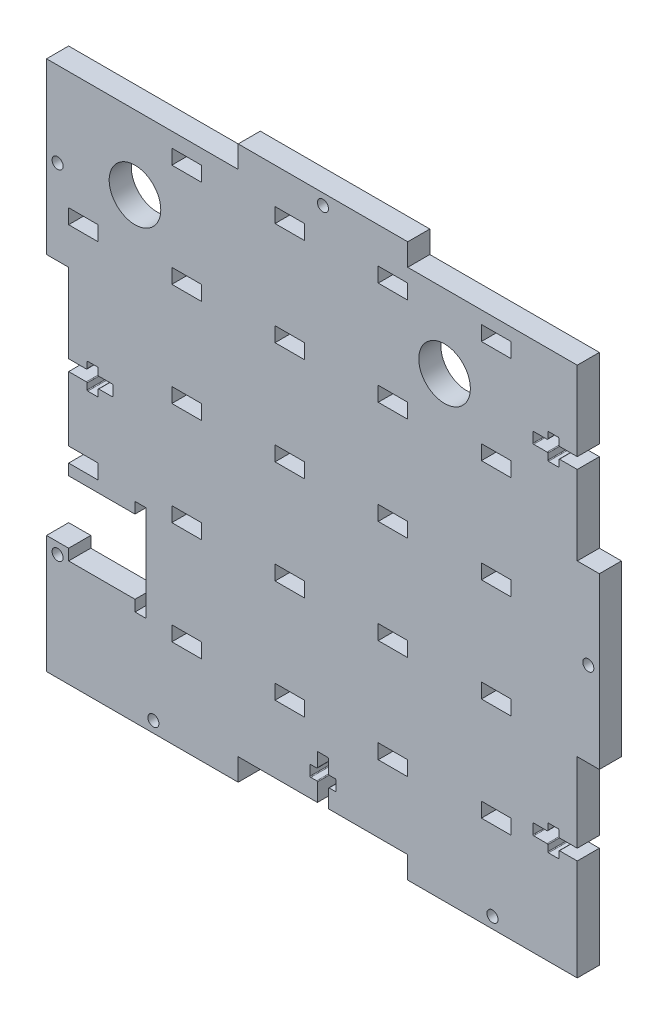
from build123d import *

# Parameters (mm, degrees)
BOX_SIDE_DEPTH       = 6
SKETCH2_R            = 1.5
SCREW_CUT_OUTS_DEPTH = 107.235587258
CUT_EXTRUDE1_DEPTH   = 107.235587258
SKETCH4_W            = 8
SKETCH4_H            = 4
CUT_EXTRUDE2_DEPTH   = 107.235587258
SKETCH5_R            = 7
CUT_EXTRUDE3_DEPTH   = 107.235587258


with BuildPart() as part:
    # Sketch1 → Box Side (new body)
    with BuildSketch(Plane.XY):
        Polygon((-69, 69), (-23, 69), (-23, 75), (23, 75), (23, 69), (69, 69), (69, 23), (75, 23), (75, -23), (69, -23), (69, -69), (69, -75), (23, -75), (23, -69), (-23, -69), (-23, -75), (-69, -75), (-75, -75), (-75, -69), (-75, -23), (-69, -23), (-69, 23), (-75, 23), (-75, 69), align=None)
    extrude(amount=BOX_SIDE_DEPTH)

    # Sketch2 → Screw Cut-outs (cut, through all)
    with BuildSketch(Plane.XY.offset(6)):
        with Locations((0, 72)):
            Circle(SKETCH2_R)
        with Locations((72, 0)):
            Circle(SKETCH2_R)
        with Locations((-46, -72)):
            Circle(SKETCH2_R)
        with Locations((46, -72)):
            Circle(SKETCH2_R)
        with Locations((-72, 46)):
            Circle(SKETCH2_R)
        with Locations((-72, -46)):
            Circle(SKETCH2_R)
        with BuildLine():
            Line((69, 44.5), (64.2, 44.5))
            ThreePointArc((64.2, 44.5), (64.058578644, 44.441421356), (64, 44.3))
            Line((64, 44.3), (64, 42.7))
            ThreePointArc((64, 42.7), (63.941421356, 42.558578644), (63.8, 42.5))
            Line((63.8, 42.5), (61.2, 42.5))
            ThreePointArc((61.2, 42.5), (61.058578644, 42.558578644), (61, 42.7))
            Line((61, 42.7), (61, 44.3))
            ThreePointArc((61, 44.3), (60.941421356, 44.441421356), (60.8, 44.5))
            Line((60.8, 44.5), (57.2, 44.5))
            ThreePointArc((57.2, 44.5), (57.058578644, 44.558578644), (57, 44.7))
            Line((57, 44.7), (57, 47.3))
            ThreePointArc((57, 47.3), (57.058578644, 47.441421356), (57.2, 47.5))
            Line((57.2, 47.5), (60.8, 47.5))
            ThreePointArc((60.8, 47.5), (60.941421356, 47.558578644), (61, 47.7))
            Line((61, 47.7), (61, 49.3))
            ThreePointArc((61, 49.3), (61.058578644, 49.441421356), (61.2, 49.5))
            Line((61.2, 49.5), (63.8, 49.5))
            ThreePointArc((63.8, 49.5), (63.941421356, 49.441421356), (64, 49.3))
            Line((64, 49.3), (64, 47.7))
            ThreePointArc((64, 47.7), (64.058578644, 47.558578644), (64.2, 47.5))
            Line((64.2, 47.5), (69, 47.5))
            Line((69, 47.5), (69, 44.5))
        make_face()
        with BuildLine():
            Line((69, -47.5), (64.2, -47.5))
            ThreePointArc((64.2, -47.5), (64.058578644, -47.558578644), (64, -47.7))
            Line((64, -47.7), (64, -49.3))
            ThreePointArc((64, -49.3), (63.941421356, -49.441421356), (63.8, -49.5))
            Line((63.8, -49.5), (61.2, -49.5))
            ThreePointArc((61.2, -49.5), (61.058578644, -49.441421356), (61, -49.3))
            Line((61, -49.3), (61, -47.7))
            ThreePointArc((61, -47.7), (60.941421356, -47.558578644), (60.8, -47.5))
            Line((60.8, -47.5), (57.2, -47.5))
            ThreePointArc((57.2, -47.5), (57.058578644, -47.441421356), (57, -47.3))
            Line((57, -47.3), (57, -44.7))
            ThreePointArc((57, -44.7), (57.058578644, -44.558578644), (57.2, -44.5))
            Line((57.2, -44.5), (60.8, -44.5))
            ThreePointArc((60.8, -44.5), (60.941421356, -44.441421356), (61, -44.3))
            Line((61, -44.3), (61, -42.7))
            ThreePointArc((61, -42.7), (61.058578644, -42.558578644), (61.2, -42.5))
            Line((61.2, -42.5), (63.8, -42.5))
            ThreePointArc((63.8, -42.5), (63.941421356, -42.558578644), (64, -42.7))
            Line((64, -42.7), (64, -44.3))
            ThreePointArc((64, -44.3), (64.058578644, -44.441421356), (64.2, -44.5))
            Line((64.2, -44.5), (69, -44.5))
            Line((69, -44.5), (69, -47.5))
        make_face()
        with BuildLine():
            Line((-1.5, -69), (1.5, -69))
            Line((1.5, -69), (1.5, -64.2))
            ThreePointArc((1.5, -64.2), (1.558578644, -64.058578644), (1.7, -64))
            Line((1.7, -64), (3.3, -64))
            ThreePointArc((3.3, -64), (3.441421356, -63.941421356), (3.5, -63.8))
            Line((3.5, -63.8), (3.5, -61.2))
            ThreePointArc((3.5, -61.2), (3.441421356, -61.058578644), (3.3, -61))
            Line((3.3, -61), (1.7, -61))
            ThreePointArc((1.7, -61), (1.558578644, -60.941421356), (1.5, -60.8))
            Line((1.5, -60.8), (1.5, -57.2))
            ThreePointArc((1.5, -57.2), (1.441421356, -57.058578644), (1.3, -57))
            Line((1.3, -57), (-1.3, -57))
            ThreePointArc((-1.3, -57), (-1.441421356, -57.058578644), (-1.5, -57.2))
            Line((-1.5, -57.2), (-1.5, -60.8))
            ThreePointArc((-1.5, -60.8), (-1.558578644, -60.941421356), (-1.7, -61))
            Line((-1.7, -61), (-3.3, -61))
            ThreePointArc((-3.3, -61), (-3.441421356, -61.058578644), (-3.5, -61.2))
            Line((-3.5, -61.2), (-3.5, -63.8))
            ThreePointArc((-3.5, -63.8), (-3.441421356, -63.941421356), (-3.3, -64))
            Line((-3.3, -64), (-1.7, -64))
            ThreePointArc((-1.7, -64), (-1.558578644, -64.058578644), (-1.5, -64.2))
            Line((-1.5, -64.2), (-1.5, -69))
        make_face()
        with BuildLine():
            Line((-69, -1.5), (-64.2, -1.5))
            ThreePointArc((-64.2, -1.5), (-64.058578644, -1.558578644), (-64, -1.7))
            Line((-64, -1.7), (-64, -3.3))
            ThreePointArc((-64, -3.3), (-63.941421356, -3.441421356), (-63.8, -3.5))
            Line((-63.8, -3.5), (-61.2, -3.5))
            ThreePointArc((-61.2, -3.5), (-61.058578644, -3.441421356), (-61, -3.3))
            Line((-61, -3.3), (-61, -1.7))
            ThreePointArc((-61, -1.7), (-60.941421356, -1.558578644), (-60.8, -1.5))
            Line((-60.8, -1.5), (-57.2, -1.5))
            ThreePointArc((-57.2, -1.5), (-57.058578644, -1.441421356), (-57, -1.3))
            Line((-57, -1.3), (-57, 1.3))
            ThreePointArc((-57, 1.3), (-57.058578644, 1.441421356), (-57.2, 1.5))
            Line((-57.2, 1.5), (-60.8, 1.5))
            ThreePointArc((-60.8, 1.5), (-60.941421356, 1.558578644), (-61, 1.7))
            Line((-61, 1.7), (-61, 3.3))
            ThreePointArc((-61, 3.3), (-61.058578644, 3.441421356), (-61.2, 3.5))
            Line((-61.2, 3.5), (-63.8, 3.5))
            ThreePointArc((-63.8, 3.5), (-63.941421356, 3.441421356), (-64, 3.3))
            Line((-64, 3.3), (-64, 1.7))
            ThreePointArc((-64, 1.7), (-64.058578644, 1.558578644), (-64.2, 1.5))
            Line((-64.2, 1.5), (-69, 1.5))
            Line((-69, 1.5), (-69, -1.5))
        make_face()
    extrude(amount=-SCREW_CUT_OUTS_DEPTH, mode=Mode.SUBTRACT)

    # Sketch3 → Cut-Extrude1 (cut, through all)
    with BuildSketch(Plane.XY.offset(6)):
        Polygon((-51, -46), (-51, -49), (-48, -49), (-48, -23), (-51, -23), (-51, -26), (-69, -26), (-69, -23), (-75, -23), (-75, -43), (-69, -43), (-69, -46), align=None)
    extrude(amount=-CUT_EXTRUDE1_DEPTH, mode=Mode.SUBTRACT)

    # Sketch4 → Cut-Extrude2 (cut, through all)
    with BuildSketch(Plane.XY.offset(6)):
        with Locations((-37, 63)):
            Rectangle(SKETCH4_W, SKETCH4_H)
        with Locations((-37, 35)):
            Rectangle(SKETCH4_W, SKETCH4_H)
        with Locations((-65, 35)):
            Rectangle(SKETCH4_W, SKETCH4_H)
        with Locations((19, 35.283560436)):
            Rectangle(SKETCH4_W, SKETCH4_H)
        with Locations((-9, 35.283560436)):
            Rectangle(SKETCH4_W, SKETCH4_H)
        with Locations((-9, 63.283560436)):
            Rectangle(SKETCH4_W, SKETCH4_H)
        with Locations((19, 63.283560436)):
            Rectangle(SKETCH4_W, SKETCH4_H)
        with Locations((47, 35.567120872)):
            Rectangle(SKETCH4_W, SKETCH4_H)
        with Locations((47, 63.567120872)):
            Rectangle(SKETCH4_W, SKETCH4_H)
        with Locations((19, -20.716439564)):
            Rectangle(SKETCH4_W, SKETCH4_H)
        with Locations((-9, -20.716439564)):
            Rectangle(SKETCH4_W, SKETCH4_H)
        with Locations((-9, 7.283560436)):
            Rectangle(SKETCH4_W, SKETCH4_H)
        with Locations((19, 7.283560436)):
            Rectangle(SKETCH4_W, SKETCH4_H)
        with Locations((47, -20.432879128)):
            Rectangle(SKETCH4_W, SKETCH4_H)
        with Locations((47, 7.567120872)):
            Rectangle(SKETCH4_W, SKETCH4_H)
        with Locations((-9, -48.716439564)):
            Rectangle(SKETCH4_W, SKETCH4_H)
        with Locations((19, -48.716439564)):
            Rectangle(SKETCH4_W, SKETCH4_H)
        with Locations((47, -48.432879128)):
            Rectangle(SKETCH4_W, SKETCH4_H)
        with Locations((-37, -21)):
            Rectangle(SKETCH4_W, SKETCH4_H)
        with Locations((-65, -21)):
            Rectangle(SKETCH4_W, SKETCH4_H)
        with Locations((-37, 7)):
            Rectangle(SKETCH4_W, SKETCH4_H)
        with Locations((-37, -49)):
            Rectangle(SKETCH4_W, SKETCH4_H)
    extrude(amount=-CUT_EXTRUDE2_DEPTH, mode=Mode.SUBTRACT)

    # Sketch5 → Cut-Extrude3 (cut, through all)
    with BuildSketch(Plane.XY.offset(6)):
        with Locations((-51, 49)):
            Circle(SKETCH5_R)
        with Locations((33, 49)):
            Circle(SKETCH5_R)
    extrude(amount=-CUT_EXTRUDE3_DEPTH, mode=Mode.SUBTRACT)


solid = part.part
